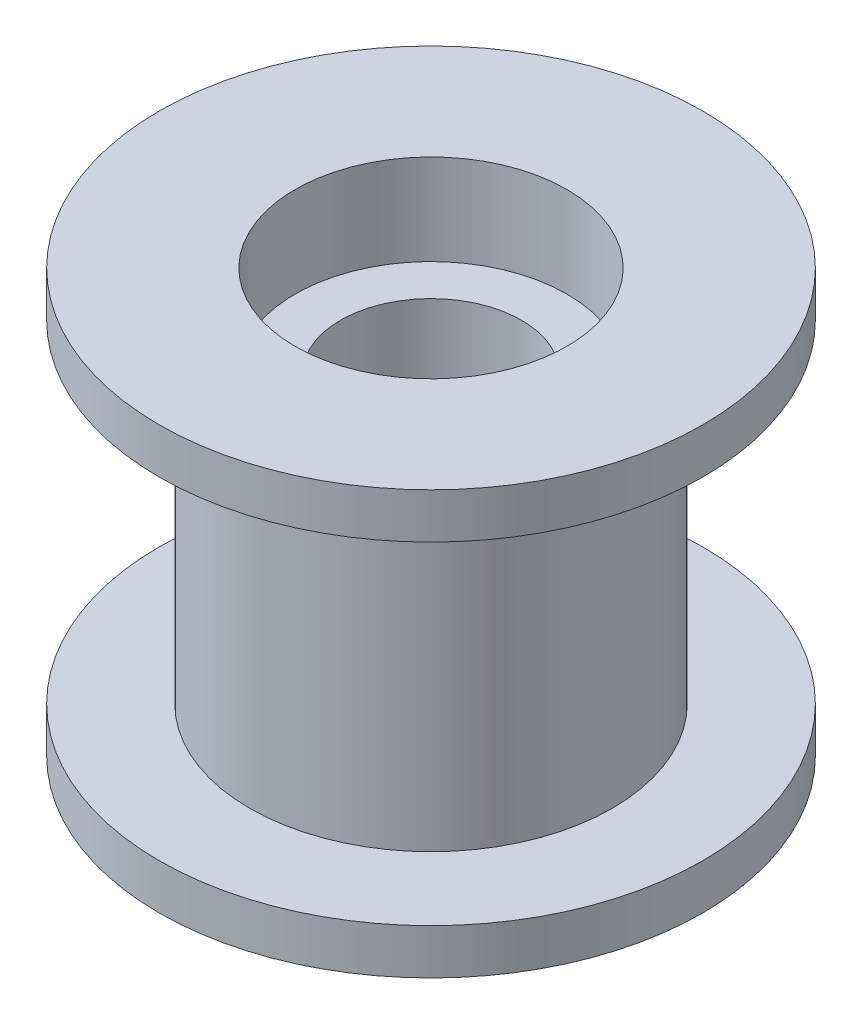
from build123d import *

# Parameters (mm, degrees)
SKETCH1_R           = 6
SKETCH1_R_2         = 4.5
BOSS_EXTRUDE1_DEPTH = 5.5
SKETCH2_R           = 9
SKETCH2_R_2         = 4.5
BOSS_EXTRUDE2_DEPTH = 1.5
SKETCH3_R           = 4.5
SKETCH3_R_2         = 3
BOSS_EXTRUDE3_DEPTH = 4


with BuildPart() as part:
    # Sketch1 → Boss-Extrude1 (new, symmetric)
    with BuildSketch(Plane(origin=(0, 0, 0), x_dir=(1, 0, 0), z_dir=(0, 1, 0))):
        Circle(SKETCH1_R)
        Circle(SKETCH1_R_2, mode=Mode.SUBTRACT)
    extrude(amount=BOSS_EXTRUDE1_DEPTH, both=True)

    # Sketch2 → Boss-Extrude2 (add)
    with BuildSketch(Plane(origin=(0, 5.5, 0), x_dir=(1, 0, 0), z_dir=(0, 1, 0))):
        Circle(SKETCH2_R)
        Circle(SKETCH2_R_2, mode=Mode.SUBTRACT)
    boss_extrude2 = extrude(amount=BOSS_EXTRUDE2_DEPTH)

    # Mirror1: Boss-Extrude2 across plane
    add(boss_extrude2.mirror(Plane.ZX))

    # Sketch3 → Boss-Extrude3 (add, symmetric)
    with BuildSketch(Plane(origin=(0, 0, 0), x_dir=(1, 0, 0), z_dir=(0, 1, 0))):
        Circle(SKETCH3_R)
        Circle(SKETCH3_R_2, mode=Mode.SUBTRACT)
    extrude(amount=BOSS_EXTRUDE3_DEPTH, both=True)


solid = part.part
